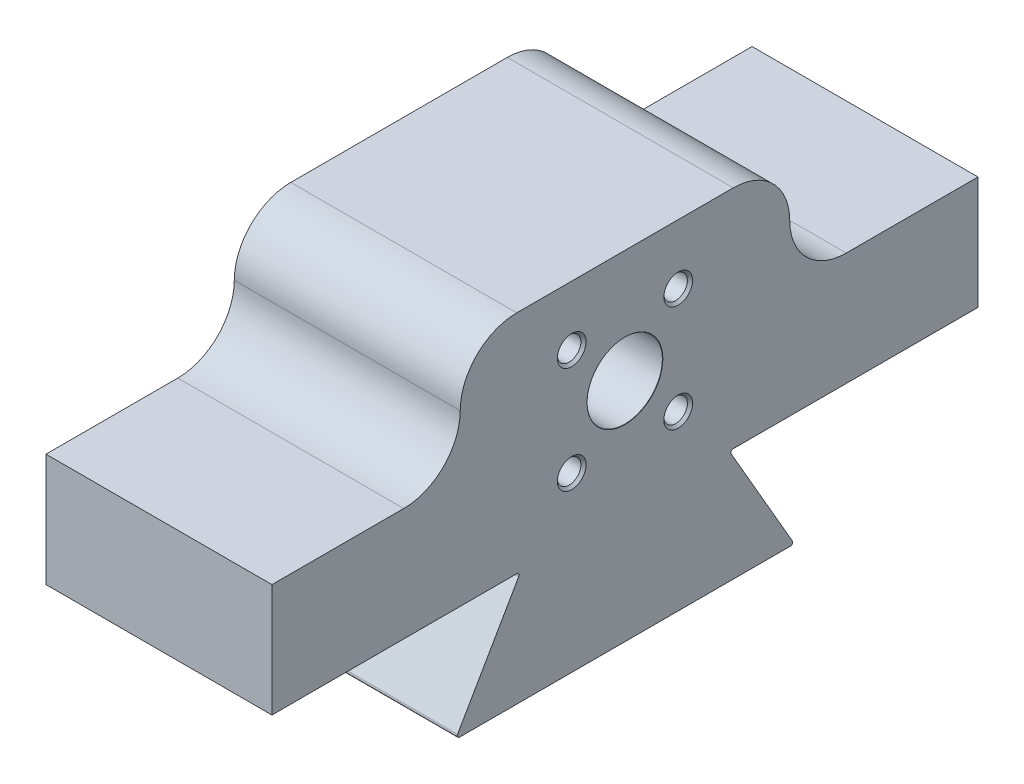
from build123d import *

# Parameters (mm, degrees)
SKETCH1_W                       = 75
SKETCH1_H                       = 24
BOSS_EXTRUDE1_DEPTH             = 24
SKETCH2_W                       = 20
SKETCH2_H                       = 12
CUT_EXTRUDE1_DEPTH              = 24
FILLET1_START                   = -1
FILLET1_DEPTH                   = 26
FILLET1_2_DEPTH                 = 24
F_8_0MM_DOWEL_HOLE1_D           = 8
F_8_0MM_DOWEL_HOLE1_DEPTH       = 15
F_8_0MM_DOWEL_HOLE1_CSINK_D     = 8.05
F_8_0MM_DOWEL_HOLE1_CSINK_ANGLE = 90
F_8_0MM_DOWEL_HOLE1_TIP         = 2.403442476
M3X0_5_TAPPED_HOLE1_D           = 2.5
M3X0_5_TAPPED_HOLE1_DEPTH       = 7.5
M3X0_5_TAPPED_HOLE1_CSINK_D     = 3.05
M3X0_5_TAPPED_HOLE1_CSINK_ANGLE = 90
M3X0_5_TAPPED_HOLE1_TIP         = 0.751075774
BOSS_EXTRUDE2_DEPTH             = 24
FILLET2_R                       = 0.25


with BuildPart() as part:
    # Sketch1 → Boss-Extrude1 (new body)
    with BuildSketch(Plane(origin=(0, 0, 0), x_dir=(0, 0, -1), z_dir=(1, 0, 0))):
        Rectangle(SKETCH1_W, SKETCH1_H)
    extrude(amount=BOSS_EXTRUDE1_DEPTH)

    # Sketch2 → Cut-Extrude1 (cut)
    with BuildSketch(Plane(origin=(24, 0, 0), x_dir=(0, 0, -1), z_dir=(1, 0, 0))):
        with Locations((-27.5, 6)):
            Rectangle(SKETCH2_W, SKETCH2_H)
    cut_extrude1 = extrude(amount=-CUT_EXTRUDE1_DEPTH, mode=Mode.SUBTRACT)

    # Fillet1: read off the stored shape, not the designer's step
    # Fillet1 outline → Fillet1 (cut)
    with BuildSketch(Plane.YZ.offset(FILLET1_START)):
        with BuildLine():
            Line((12, 17.5), (6, 17.5))
            ThreePointArc((6, 17.5), (10.242640687, 15.742640687), (12, 11.5))
            Line((12, 11.5), (12, 17.5))
        make_face()
    fillet1 = extrude(amount=FILLET1_DEPTH, mode=Mode.SUBTRACT)

    # Fillet1 2 outline → Fillet1 2 (add)
    with BuildSketch(Plane.YZ):
        with BuildLine():
            Line((0, 17.5), (6, 17.5))
            ThreePointArc((6, 17.5), (1.757359313, 19.257359313), (0, 23.5))
            Line((0, 23.5), (0, 17.5))
        make_face()
    fillet1_2 = extrude(amount=FILLET1_2_DEPTH)

    # Mirror1: Cut-Extrude1, Fillet1, Fillet1 2 across plane
    add(cut_extrude1.mirror(Plane.XY), mode=Mode.SUBTRACT)
    add(fillet1.mirror(Plane.XY), mode=Mode.SUBTRACT)
    add(fillet1_2.mirror(Plane.XY))

    # Ø8.0mm Dowel Hole1
    with Locations(Plane(origin=(24, 0, 0), x_dir=(0, 0, -1), z_dir=(1, 0, 0))):
        with Locations((0, 0)):
            CounterSinkHole(F_8_0MM_DOWEL_HOLE1_D / 2, F_8_0MM_DOWEL_HOLE1_CSINK_D / 2, depth=F_8_0MM_DOWEL_HOLE1_DEPTH, counter_sink_angle=F_8_0MM_DOWEL_HOLE1_CSINK_ANGLE)
            with Locations((0, 0, -(F_8_0MM_DOWEL_HOLE1_DEPTH + F_8_0MM_DOWEL_HOLE1_TIP / 2))):  # 118° drill point
                Cone(0, F_8_0MM_DOWEL_HOLE1_D / 2, F_8_0MM_DOWEL_HOLE1_TIP, mode=Mode.SUBTRACT)

    # M3x0.5 Tapped Hole1
    with Locations(Plane(origin=(24, 0, 0), x_dir=(0, 0, -1), z_dir=(1, 0, 0))):
        with Locations((-5.656854249, 5.656854249), (5.656854249, 5.656854249), (5.656854249, -5.656854249), (-5.656854249, -5.656854249)):
            CounterSinkHole(M3X0_5_TAPPED_HOLE1_D / 2, M3X0_5_TAPPED_HOLE1_CSINK_D / 2, depth=M3X0_5_TAPPED_HOLE1_DEPTH, counter_sink_angle=M3X0_5_TAPPED_HOLE1_CSINK_ANGLE)
            with Locations((0, 0, -(M3X0_5_TAPPED_HOLE1_DEPTH + M3X0_5_TAPPED_HOLE1_TIP / 2))):  # 118° drill point
                Cone(0, M3X0_5_TAPPED_HOLE1_D / 2, M3X0_5_TAPPED_HOLE1_TIP, mode=Mode.SUBTRACT)

    # Sketch12 → Boss-Extrude2 (add)
    with BuildSketch(Plane(origin=(24, 0, 0), x_dir=(0, 0, -1), z_dir=(1, 0, 0))):
        Polygon((-18, -24), (18, -24), (11.07179677, -12), (-11.07179677, -12), align=None)
    extrude(amount=-BOSS_EXTRUDE2_DEPTH)

    # Fillet2
    fillet2_edges = [part.edges().sort_by_distance(p)[0] for p in [
        (12, -12, 11.07179677),
        (12, -24, 18),
        (12, -24, -18),
        (12, -12, -11.07179677),
    ]]
    fillet(fillet2_edges, radius=FILLET2_R)


solid = part.part
